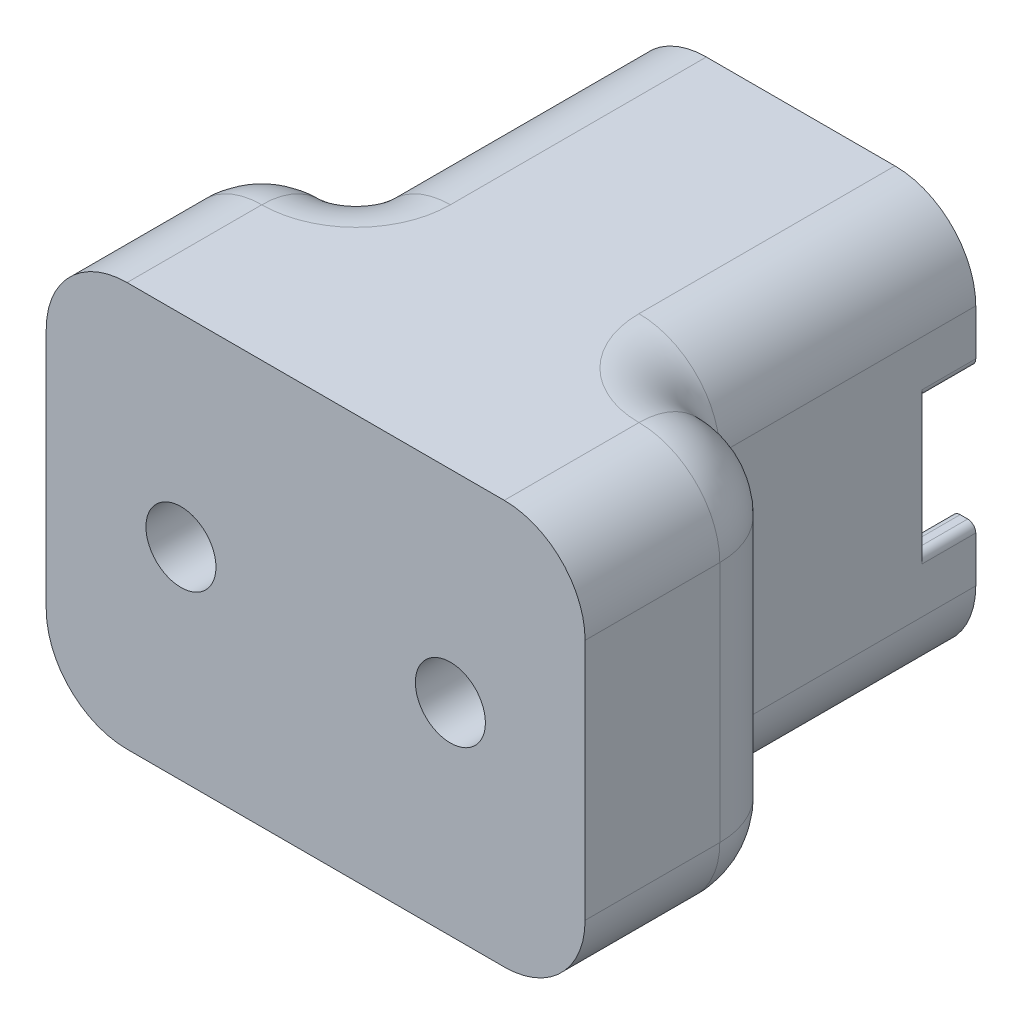
from build123d import *

# Parameters (mm, degrees)
SKETCH_1_W          = 13
SKETCH_1_H          = 15
EXTRUDE_1_DEPTH     = 10
SKETCH_2_W          = 20
SKETCH_2_H          = 15
EXTRUDE_2_DEPTH     = 8
SKETCH_6_R          = 6.25
SKETCH_6_W          = 13
SKETCH_6_H          = 5
CUT_EXTRUDE_3_DEPTH = 2
SKETCH_8_R          = 1.3
CUT_EXTRUDE_5_DEPTH = 10
FILLET_7_R          = 0.5
FILLET_8_R          = 3
FILLET_9_R          = 3
FILLET_10_R         = 0.3


with BuildPart() as part:
    # ｽｹｯﾁ1 → ﾎﾞｽ - 押し出し1 (new body)
    with BuildSketch(Plane.XY):
        Rectangle(SKETCH_1_W, SKETCH_1_H)
    extrude(amount=EXTRUDE_1_DEPTH)

    # ｽｹｯﾁ2 → ﾎﾞｽ - 押し出し2 (add)
    with BuildSketch(Plane.XY.offset(10)):
        Rectangle(SKETCH_2_W, SKETCH_2_H)
    extrude(amount=EXTRUDE_2_DEPTH)

    # ｽｹｯﾁ6 → ｶｯﾄ - 押し出し3 (cut)
    with BuildSketch(Plane(origin=(0, 0, 0), x_dir=(-1, 0, 0), z_dir=(0, 0, -1))):
        Circle(SKETCH_6_R)
        Rectangle(SKETCH_6_W, SKETCH_6_H)
    extrude(amount=-CUT_EXTRUDE_3_DEPTH, mode=Mode.SUBTRACT)

    # ｽｹｯﾁ8 → ｶｯﾄ - 押し出し5 (cut)
    with BuildSketch(Plane.XY.offset(18)):
        with Locations((-5, 0)):
            Circle(SKETCH_8_R)
        with Locations((5, 0)):
            Circle(SKETCH_8_R)
    extrude(amount=-CUT_EXTRUDE_5_DEPTH, mode=Mode.SUBTRACT)

    # ﾌｨﾚｯﾄ7
    fillet_7_edges = [part.edges().sort_by_distance(p)[0] for p in [
        (6.5, 0, 10),
        (-6.5, 0, 10),
    ]]
    fillet(fillet_7_edges, radius=FILLET_7_R)

    # ﾌｨﾚｯﾄ8
    fillet_8_edges = [part.edges().sort_by_distance(p)[0] for p in [
        (10, 0, 10),
        (-10, 0, 10),
    ]]
    fillet(fillet_8_edges, radius=FILLET_8_R - 0.0001)  # a hair under: the kernel refuses the full size

    # ﾌｨﾚｯﾄ9
    fillet_9_edges = [part.edges().sort_by_distance(p)[0] for p in [
        (-10, 7.5, 15.49995),
        (-10, -7.5, 15.49995),
        (10, -7.5, 15.49995),
        (10, 7.5, 15.49995),
        (-6.5, -7.5, 4.75),
        (-6.5, 7.5, 4.75),
        (6.5, 7.5, 4.75),
        (6.5, -7.5, 4.75),
        (-6.646446609, -7.5, 9.853553391),
        (-6.646446609, 7.5, 9.853553391),
        (6.646446609, 7.5, 9.853553391),
        (6.646446609, -7.5, 9.853553391),
        (-9.121349633, 7.5, 10.878650367),
        (9.121349633, 7.5, 10.878650367),
        (-9.121349633, -7.5, 10.878650367),
        (9.121349633, -7.5, 10.878650367),
    ]]
    fillet(fillet_9_edges, radius=FILLET_9_R - 0.0001)  # a hair under: the kernel refuses the full size

    # ﾌｨﾚｯﾄ10
    fillet_10_edges = [part.edges().sort_by_distance(p)[0] for p in [
        (-6.5, 2.5, 1),
        (-5.728219619, 2.5, 1),
        (-6.5, -2.5, 1),
        (5.728219619, -2.5, 1),
        (-5.728219619, -2.5, 1),
        (6.5, -2.5, 1),
        (5.728219619, 2.5, 1),
        (6.5, 2.5, 1),
    ]]
    fillet(fillet_10_edges, radius=FILLET_10_R)


solid = part.part
